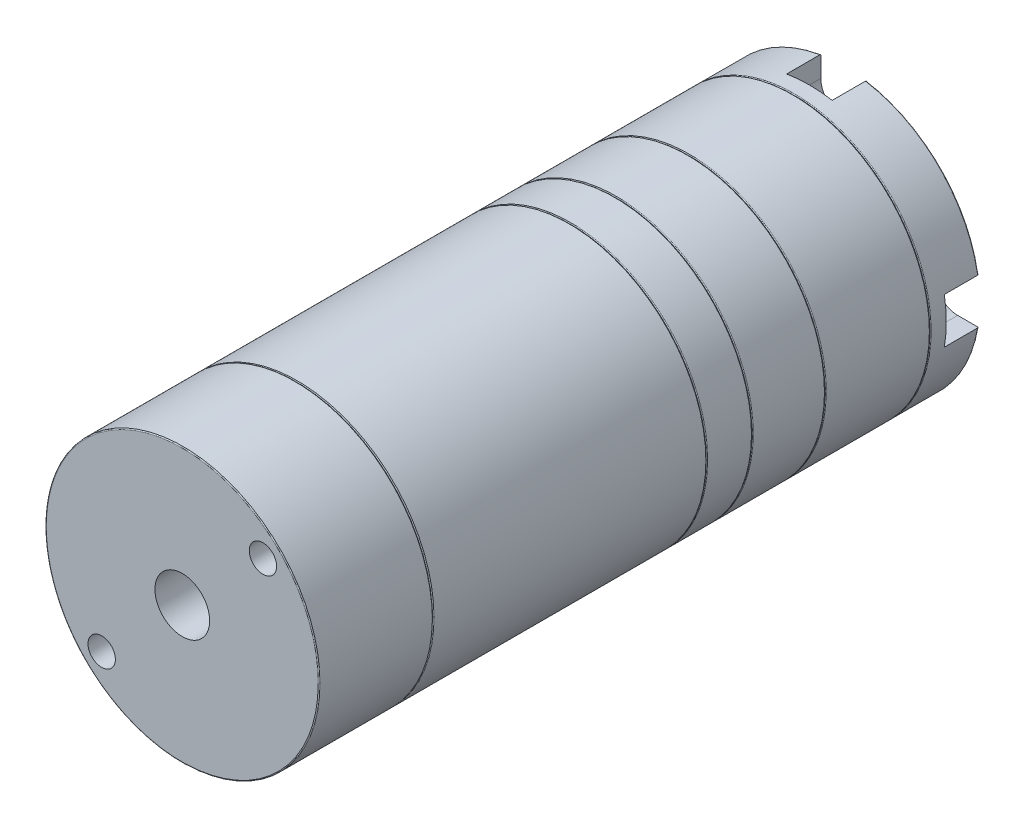
from build123d import *

# Parameters (mm, degrees)
SKETCH3_W                  = 30
SKETCH3_H                  = 25
FILLET1_R                  = 0.2
SKETCH3_3_W                = 30
SKETCH3_3_H                = 60
FILLET2_R                  = 0.2
SKETCH3_4_W                = 30
SKETCH3_4_H                = 10
FILLET3_R                  = 0.2
SKETCH3_5_W                = 30
SKETCH3_5_H                = 16
FILLET5_R                  = 0.2
SKETCH3_6_W                = 30
SKETCH3_6_H                = 23
FILLET6_R                  = 0.2
FILLET7_R                  = 0.2
SKETCH4_R                  = 12
CUT_EXTRUDE1_DEPTH         = 6
SKETCH5_R                  = 6
CUT_EXTRUDE2_DEPTH         = 149.202564121
CUT_EXTRUDE3_DEPTH         = 7.5
M5_TAPPED_HOLE2_AT_2_COUNT = 2
M5_TAPPED_HOLE2_AT_2_PITCH = 35.355339059
M5_TAPPED_HOLE2_AT_3_COUNT = 2
M5_TAPPED_HOLE2_AT_3_PITCH = 50
M5_TAPPED_HOLE2_AT_4_COUNT = 2
M5_TAPPED_HOLE2_AT_4_PITCH = 35.355339059
SKETCH11_R                 = 3
CUT_EXTRUDE4_DEPTH         = 7.5


# Read off the part's stored shape, not the designer's step: M5 Tapped Hole1
# Some blends are built 0.0001 mm under size
with BuildPart() as part:
    # Sketch3 → Revolve1 (revolve)
    with BuildSketch(Plane(origin=(0, 0, 0), x_dir=(1, 0, 0), z_dir=(0, 1, 0)), mode=Mode.PRIVATE) as revolve1_sk:
        with Locations((-15, 12.5)):
            Rectangle(SKETCH3_W, SKETCH3_H)
    revolve(revolve1_sk.sketch.rotate(Axis((0, 0, 0), (0, 0, -1)), 180), axis=Axis((0, 0, 0), (0, 0, -1)))

    # Fillet1
    fillet1_edges = [part.edges().sort_by_distance(p)[0] for p in [
        (-30, 0, 0),
        (-30, 0, -25),
    ]]
    fillet(fillet1_edges, radius=FILLET1_R)


with BuildPart() as body_2:
    # Sketch3<3> → Revolve2 (revolve)
    with BuildSketch(Plane(origin=(0, 0, 0), x_dir=(1, 0, 0), z_dir=(0, 1, 0)), mode=Mode.PRIVATE) as revolve2_sk:
        with Locations((-15, 55)):
            Rectangle(SKETCH3_3_W, SKETCH3_3_H)
    revolve(revolve2_sk.sketch.rotate(Axis((0, 0, 0), (0, 0, -1)), 180), axis=Axis((0, 0, 0), (0, 0, -1)))

    # Fillet2
    fillet2_edges = [body_2.edges().sort_by_distance(p)[0] for p in [
        (-30, 0, -25),
        (-30, 0, -85),
    ]]
    fillet(fillet2_edges, radius=FILLET2_R)

    # Sketch3<4> → Revolve3 (revolve)
    with BuildSketch(Plane(origin=(0, 0, 0), x_dir=(1, 0, 0), z_dir=(0, 1, 0))):
        with Locations((-15, 90)):
            Rectangle(SKETCH3_4_W, SKETCH3_4_H)
    revolve(axis=Axis((0, 0, 0), (0, 0, -1)))

    # Fillet3
    fillet3_edges = [body_2.edges().sort_by_distance(p)[0] for p in [
        (30, 0, -85),
        (30, 0, -95),
    ]]
    fillet(fillet3_edges, radius=FILLET3_R - 0.0001)  # a hair under: the kernel refuses the full size

    # Sketch3<5> → Revolve4 (revolve)
    with BuildSketch(Plane(origin=(0, 0, 0), x_dir=(1, 0, 0), z_dir=(0, 1, 0))):
        with Locations((-15, 103)):
            Rectangle(SKETCH3_5_W, SKETCH3_5_H)
    revolve(axis=Axis((0, 0, 0), (0, 0, -1)))

    # Fillet5
    # the kernel refuses this fillet: 0.2 mm, written as the material it takes off along each edge
    with BuildSketch(Plane(origin=(0, 0, -95), x_dir=(-1, 0, 0), z_dir=(0, -1, 0))) as fillet5_piece_1:
        with BuildLine():
            CenterArc((29.8, 0.199999975), FILLET5_R, 270.028647891, 89.971352109)
            Line((30, 0.199999975), (30, 0))
            Line((30, 0), (29.8001, 0))
        make_face()
    revolve(axis=Axis((0, 0, -95), (0, 0, -1)), mode=Mode.SUBTRACT)
    with BuildSketch(Plane(origin=(0, 0, -111), x_dir=(-1, 0, 0), z_dir=(0, -1, 0))) as fillet5_piece_2:
        with BuildLine():
            CenterArc((30 - FILLET5_R, -FILLET5_R), FILLET5_R, 0, 90)
            Line((30 - FILLET5_R, 0), (30, 0))
            Line((30, 0), (30, -FILLET5_R))
        make_face()
    revolve(axis=Axis((0, 0, -111), (0, 0, -1)), mode=Mode.SUBTRACT)

    # Sketch3<6> → Revolve5 (revolve)
    with BuildSketch(Plane(origin=(0, 0, 0), x_dir=(1, 0, 0), z_dir=(0, 1, 0))):
        with Locations((-15, 122.5)):
            Rectangle(SKETCH3_6_W, SKETCH3_6_H)
    revolve(axis=Axis((0, 0, 0), (0, 0, -1)))

    # Fillet6
    fillet6_edges = [body_2.edges().sort_by_distance(p)[0] for p in [
        (30, 0, -111),
        (30, 0, -134),
    ]]
    fillet(fillet6_edges, radius=FILLET6_R - 0.0001)  # a hair under: the kernel refuses the full size

    # Sketch3<7> → Revolve6 (revolve)
    with BuildSketch(Plane(origin=(0, 0, 0), x_dir=(1, 0, 0), z_dir=(0, 1, 0))):
        Polygon((-30, 134), (0, 134), (0, 145), (0, 148), (-12.5, 148), (-12.5, 145), (-30, 145), align=None)
    revolve(axis=Axis((0, 0, 0), (0, 0, -1)))

    # Fillet7
    # the kernel refuses this fillet: 0.2 mm, written as the material it takes off along each edge
    with BuildSketch(Plane(origin=(0, 0, -145), x_dir=(-1, 0, 0), z_dir=(0, -1, 0))) as fillet7_piece_1:
        with BuildLine():
            CenterArc((30 - FILLET7_R, -FILLET7_R), FILLET7_R, 0, 90)
            Line((30 - FILLET7_R, 0), (30, 0))
            Line((30, 0), (30, -FILLET7_R))
        make_face()
    revolve(axis=Axis((0, 0, -145), (0, 0, -1)), mode=Mode.SUBTRACT)
    with BuildSketch(Plane(origin=(0, 0, -134), x_dir=(-1, 0, 0), z_dir=(0, -1, 0))) as fillet7_piece_2:
        with BuildLine():
            CenterArc((29.8, 0.199999975), FILLET7_R, 270.028647891, 89.971352109)
            Line((30, 0.199999975), (30, 0))
            Line((30, 0), (29.8001, 0))
        make_face()
    revolve(axis=Axis((0, 0, -134), (0, 0, -1)), mode=Mode.SUBTRACT)

    # Sketch4 → Cut-Extrude1 (cut)
    with BuildSketch(Plane(origin=(0, 0, -148), x_dir=(-1, 0, 0), z_dir=(0, 0, -1))):
        Circle(SKETCH4_R)
    extrude(amount=-CUT_EXTRUDE1_DEPTH, mode=Mode.SUBTRACT)


with BuildPart() as cut_extrude2_tool:
    # Sketch5 → Cut-Extrude2 (new, through all)
    with BuildSketch(Plane(origin=(0, 0, -142), x_dir=(-1, 0, 0), z_dir=(0, 0, -1))):
        Circle(SKETCH5_R)
    extrude(amount=-CUT_EXTRUDE2_DEPTH)


with BuildPart() as part_1:
    add(part.part)

    # Cut-Extrude2: cut by cut_extrude2_tool
    add(cut_extrude2_tool.part, mode=Mode.SUBTRACT)

    # Sketch11 → Cut-Extrude4 (cut)
    with BuildSketch(Plane.XY):
        with Locations((-17.67766953, -17.67766953)):
            Circle(SKETCH11_R)
        with Locations((17.67766953, 17.67766953)):
            Circle(SKETCH11_R)
    extrude(amount=-CUT_EXTRUDE4_DEPTH, mode=Mode.SUBTRACT)


with BuildPart() as body_2_1:
    add(body_2.part)

    # Cut-Extrude2: cut by cut_extrude2_tool
    add(cut_extrude2_tool.part, mode=Mode.SUBTRACT)

    # Sketch7 → Cut-Extrude3 (cut)
    with BuildSketch(Plane(origin=(0, 0, -145), x_dir=(-1, 0, 0), z_dir=(0, 0, -1))):
        with BuildLine():
            Line((5, -25), (5, -34.718950848))
            ThreePointArc((5, -34.718950848), (0, -39.718950848), (-5, -34.718950848))
            Line((-5, -34.718950848), (-5, -25))
            ThreePointArc((-5, -25), (0, -20), (5, -25))
        make_face()
        with BuildLine():
            Line((-25, -5), (-34.718950848, -5))
            ThreePointArc((-34.718950848, -5), (-39.718950848, 0), (-34.718950848, 5))
            Line((-34.718950848, 5), (-25, 5))
            ThreePointArc((-25, 5), (-20, 0), (-25, -5))
        make_face()
        with BuildLine():
            Line((-5, 25), (-5, 34.718950848))
            ThreePointArc((-5, 34.718950848), (0, 39.718950848), (5, 34.718950848))
            Line((5, 34.718950848), (5, 25))
            ThreePointArc((5, 25), (0, 20), (-5, 25))
        make_face()
        with BuildLine():
            Line((25, 5), (34.718950848, 5))
            ThreePointArc((34.718950848, 5), (39.718950848, 0), (34.718950848, -5))
            Line((34.718950848, -5), (25, -5))
            ThreePointArc((25, -5), (20, 0), (25, 5))
        make_face()
    extrude(amount=-CUT_EXTRUDE3_DEPTH, mode=Mode.SUBTRACT)

    # M5 Tapped Hole1 outline → M5 Tapped Hole1 (revolve, cut)
    with BuildSketch(Plane(origin=(-25, 0, 0), x_dir=(1, 0, 0), z_dir=(0, -1, 0))):
        Polygon((2.1, -127.5), (0, -126.2381927), (0, -137.5), (2.1, -137.5), align=None)
    revolve(axis=Axis((-25, 0, 0), (0, 0, 1)), mode=Mode.SUBTRACT)

    # M5 Tapped Hole1 2 outline → M5 Tapped Hole1 2 (revolve, cut)
    with BuildSketch(Plane.XZ.offset(-25)):
        Polygon((2.1, -127.5), (0, -126.2381927), (0, -137.5), (2.1, -137.5), align=None)
    revolve(axis=Axis((0, 25, 0), (0, 0, 1)), mode=Mode.SUBTRACT)

    # M5 Tapped Hole1 3 outline → M5 Tapped Hole1 3 (revolve, cut)
    with BuildSketch(Plane(origin=(25, 0, 0), x_dir=(1, 0, 0), z_dir=(0, -1, 0))):
        Polygon((2.1, -127.5), (0, -126.2381927), (0, -137.5), (2.1, -137.5), align=None)
    revolve(axis=Axis((25, 0, 0), (0, 0, 1)), mode=Mode.SUBTRACT)

    # M5 Tapped Hole1 4 outline → M5 Tapped Hole1 4 (revolve, cut)
    with BuildSketch(Plane.XZ.offset(25)):
        Polygon((2.1, -135), (0, -133.7381927), (0, -137.5), (2.1, -137.5), align=None)
    revolve(axis=Axis((0, -25, 0), (0, 0, 1)), mode=Mode.SUBTRACT)

    # Sketch10 → M5 Tapped Hole2 (revolve, cut)
    with BuildSketch(Plane(origin=(17.67766953, 17.67766953, -145), x_dir=(0, 1, 0), z_dir=(1, 0, 0))):
        Polygon((0, 0), (0, 13.2618073), (2.1, 12), (2.1, 0), align=None)
    m5_tapped_hole2 = revolve(axis=Axis((17.67766953, 17.67766953, -151.35), (0, 0, 1)), mode=Mode.SUBTRACT)

    # M5 Tapped Hole2 at 2: M5 Tapped Hole2 ×2
    with Locations(*[(-i * M5_TAPPED_HOLE2_AT_2_PITCH, 0, 0) for i in range(1, M5_TAPPED_HOLE2_AT_2_COUNT)]):
        add(m5_tapped_hole2, mode=Mode.SUBTRACT)

    # M5 Tapped Hole2 at 3: M5 Tapped Hole2 ×2
    with Locations(*[Vector(-0.7071067811865471, -0.7071067811865479, 0) * (i * M5_TAPPED_HOLE2_AT_3_PITCH) for i in range(1, M5_TAPPED_HOLE2_AT_3_COUNT)]):
        add(m5_tapped_hole2, mode=Mode.SUBTRACT)

    # M5 Tapped Hole2 at 4: M5 Tapped Hole2 ×2
    with Locations(*[(0, -i * M5_TAPPED_HOLE2_AT_4_PITCH, 0) for i in range(1, M5_TAPPED_HOLE2_AT_4_COUNT)]):
        add(m5_tapped_hole2, mode=Mode.SUBTRACT)


solid = Compound([part_1.part, body_2_1.part])
